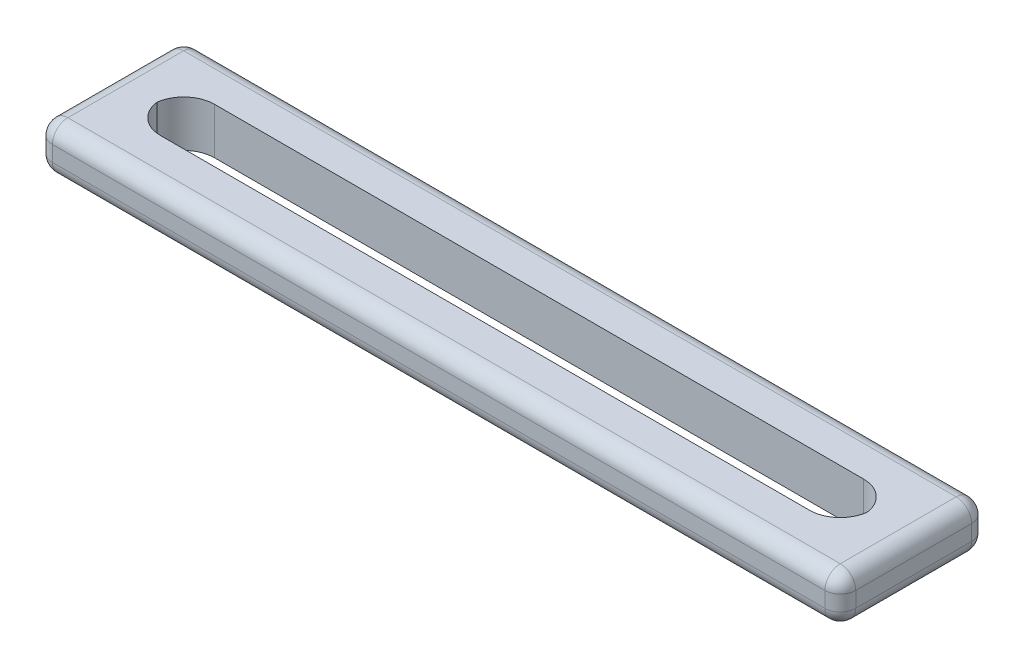
from build123d import *

# Parameters (mm, degrees)
SKETCH2_W           = 52
SKETCH2_H           = 9.5
SKETCH2_W_2         = 46
SKETCH2_H_2         = 3.5
BOSS_EXTRUDE1_DEPTH = 3
FILLET1_R           = 2
FILLET2_R           = 1


with BuildPart() as part:
    # Sketch2 → Boss-Extrude1 (new body)
    with BuildSketch(Plane(origin=(0, 0, 0), x_dir=(1, 0, 0), z_dir=(0, 1, 0))):
        with Locations((10.397099769, -9.98104869)):
            Rectangle(SKETCH2_W, SKETCH2_H)
        with Locations((10.397099769, -9.98104869)):
            Rectangle(SKETCH2_W_2, SKETCH2_H_2, mode=Mode.SUBTRACT)
    extrude(amount=BOSS_EXTRUDE1_DEPTH)

    # Fillet1
    # the kernel refuses this fillet: 2 mm, written as the material it adds along each edge
    with BuildSketch(Plane(origin=(33.397099769, 0, 11.73104869), x_dir=(-1, 0, 0), z_dir=(0, 1, 0)), Plane(origin=(33.397099769, 0, 8.23104869), x_dir=(0, 0, 1), z_dir=(0, 1, 0)), Plane(origin=(-12.602900231, 0, 11.73104869), x_dir=(0, 0, -1), z_dir=(0, 1, 0))) as fillet1_piece_1:
        with BuildLine():
            CenterArc((FILLET1_R, -FILLET1_R), FILLET1_R, 90, 90)
            Line((0, -FILLET1_R), (0, 0))
            Line((0, 0), (FILLET1_R, 0))
        make_face()
    extrude(amount=3)
    with BuildSketch(Plane(origin=(-12.602900231, 0, 8.23104869), x_dir=(0, 0, 1), z_dir=(0, 1, 0))) as fillet1_piece_2:
        with BuildLine():
            CenterArc((FILLET1_R, FILLET1_R), FILLET1_R, 180, 90)
            Line((0, FILLET1_R), (0, 0))
            Line((0, 0), (FILLET1_R, 0))
        make_face()
    extrude(amount=3)

    # Fillet2
    fillet2_edges = [part.edges().sort_by_distance(p)[0] for p in [
        (36.397099769, 3, 9.98104869),
        (10.397099769, 3, 5.23104869),
        (-15.602900231, 3, 9.98104869),
        (10.397099769, 0, 5.23104869),
        (36.397099769, 0, 9.98104869),
        (10.397099769, 0, 14.73104869),
        (-15.602900231, 0, 9.98104869),
        (-15.602900231, 1.5, 5.23104869),
        (36.397099769, 1.5, 5.23104869),
        (36.397099769, 1.5, 14.73104869),
        (-15.602900231, 1.5, 14.73104869),
        (10.397099769, 3, 14.73104869),
    ]]
    fillet(fillet2_edges, radius=FILLET2_R)


solid = part.part
